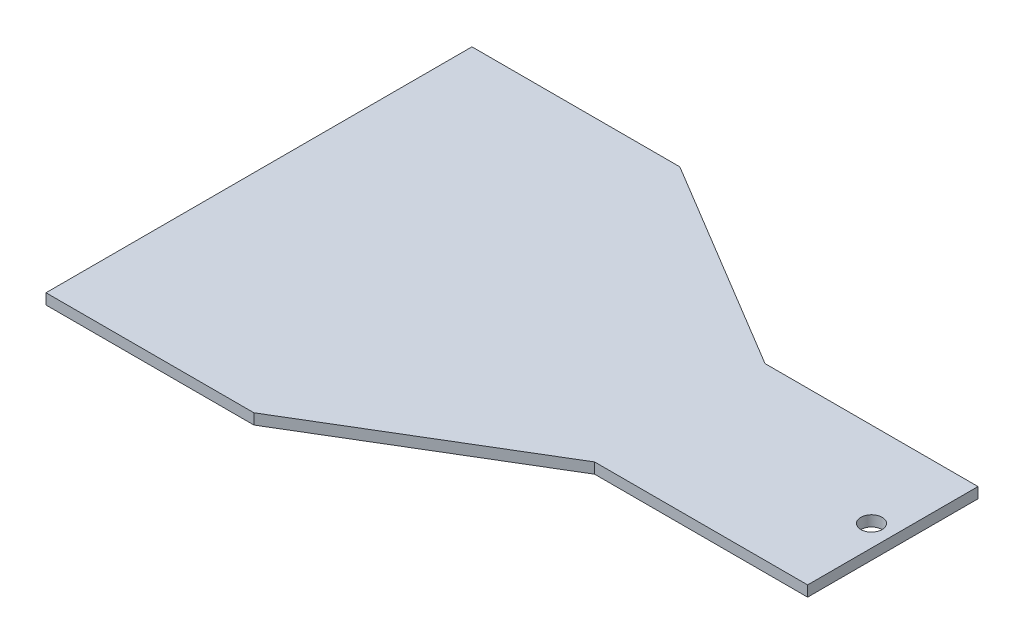
from build123d import *

# Parameters (mm, degrees)
SKETCH1_R           = 3.175
BOSS_EXTRUDE1_DEPTH = 3.175


with BuildPart() as part:
    # Sketch1 → Boss-Extrude1 (new body)
    with BuildSketch(Plane(origin=(0, 0, 0), x_dir=(1, 0, 0), z_dir=(0, 1, 0))):
        Polygon((61.976, 0), (125.476, 38.1), (188.976, 38.1), (188.976, 88.9), (125.476, 88.9), (61.976, 127), (0, 127), (0, 0), align=None)
        with Locations((182.626, 63.5)):
            Circle(SKETCH1_R, mode=Mode.SUBTRACT)
    extrude(amount=BOSS_EXTRUDE1_DEPTH)


solid = part.part
